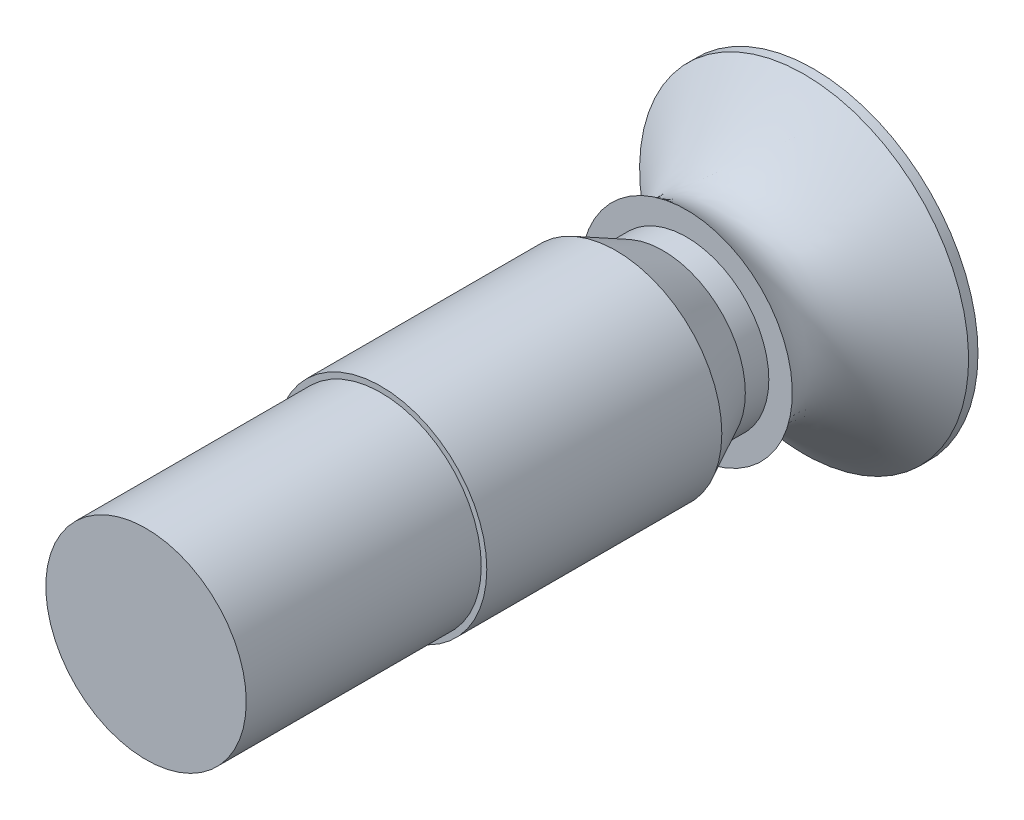
from build123d import *

# Parameters (mm, degrees)
SKETCH_1_R      = 35
EXTRUDE_1_DEPTH = 2
SKETCH_3_R      = 17.5
EXTRUDE_2_DEPTH = 5
SKETCH_4_R      = 22.5
SKETCH_5_R      = 22.5
EXTRUDE_3_DEPTH = 50
SKETCH_6_R      = 21.322035414
EXTRUDE_4_DEPTH = 50


with BuildPart() as part:
    # 스케치1 → 보스-돌출1 (new body)
    with BuildSketch(Plane.XY):
        Circle(SKETCH_1_R)
    extrude(amount=EXTRUDE_1_DEPTH)

    # 로프트1: read off the stored shape, not the designer's step
    # 로프트1: loft between two sections, ruled curve by curve
    loft_1_from = [
        Edge.make_bspline([(-20.830307169, 8.505780579, 27), (-3.81874601, 50.166394916, 27), (37.841868327, 33.154833758, 27), (20.830307169, -8.505780579, 27), (3.81874601, -50.166394916, 27), (-37.841868327, -33.154833758, 27), (-20.830307169, 8.505780579, 27)], [0, 0, 0, 0, 0.5, 0.5, 0.5, 1, 1, 1, 1], 3, [1, 0.333333333, 0.333333333, 1, 0.333333333, 0.333333333, 1]),
    ]
    loft_1_to = [
        Edge.make_bspline([(10.501396718, 33.38743277, 2), (77.276262258, 12.384639333, 2), (56.273468821, -54.390226207, 2), (-10.501396718, -33.38743277, 2), (-77.276262258, -12.384639333, 2), (-56.273468821, 54.390226207, 2), (10.501396718, 33.38743277, 2)], [0, 0, 0, 0, 0.5, 0.5, 0.5, 1, 1, 1, 1], 3, [1, 0.333333333, 0.333333333, 1, 0.333333333, 0.333333333, 1]),
    ]
    loft_1 = Solid(Shell([*[Face.make_surface_from_curves(loft_1_from[k], loft_1_to[k]) for k in range(1)], Face(Wire(loft_1_from)), Face(Wire(loft_1_to))]))
    add(loft_1)

    # 스케치3 → 보스-돌출2 (add)
    with BuildSketch(Plane.XY.offset(27)):
        Circle(SKETCH_3_R)
    extrude(amount=EXTRUDE_2_DEPTH)

    # 스케치4 → section 0 of loft_2
    with BuildSketch(Plane.XY.offset(42), mode=Mode.PRIVATE) as loft_2_s0:
        Circle(SKETCH_4_R)
    # loft up to a face of the part (loft_2)
    loft([loft_2_s0.sketch, Face(Wire([part.edges().sort_by_distance((-11.979574354, 12.75695098, 32))[0]]))])

    # 스케치5 → 보스-돌출3 (add)
    with BuildSketch(Plane.XY.offset(42)):
        Circle(SKETCH_5_R)
    extrude(amount=EXTRUDE_3_DEPTH)

    # 스케치6 → 보스-돌출4 (add)
    with BuildSketch(Plane.XY.offset(92)):
        Circle(SKETCH_6_R)
    extrude(amount=EXTRUDE_4_DEPTH)


solid = part.part
